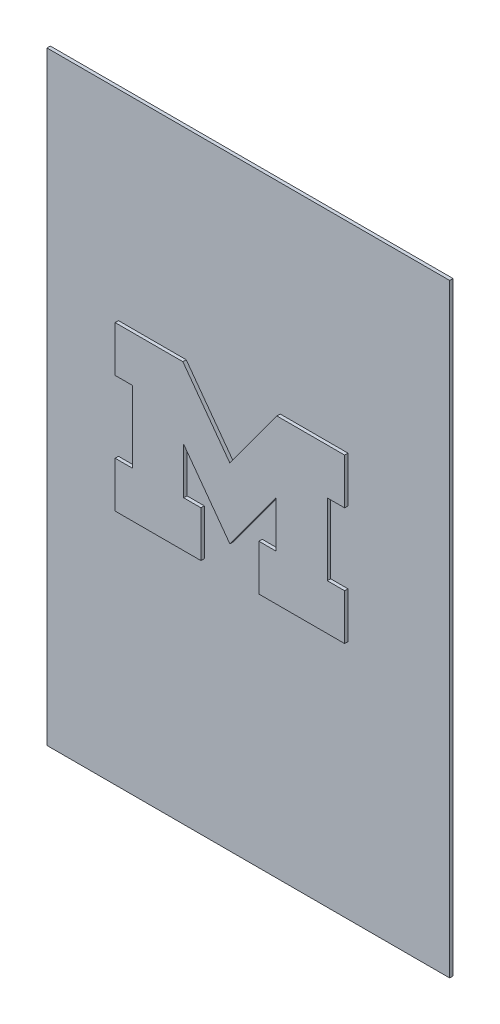
from build123d import *

# Parameters (mm, degrees)
SKETCH1_W           = 304.8
SKETCH1_H           = 457.2
BOSS_EXTRUDE1_DEPTH = 2.54
BOSS_EXTRUDE3_DEPTH = 2.54


with BuildPart() as part:
    # Sketch1 → Boss-Extrude1 (new body)
    with BuildSketch(Plane.XY):
        with Locations((152.4, 228.6)):
            Rectangle(SKETCH1_W, SKETCH1_H)
    extrude(amount=BOSS_EXTRUDE1_DEPTH)

    # Sketch3 → Boss-Extrude3 (add)
    with BuildSketch(Plane.XY.offset(2.54)):
        Polygon((144.017104059, 261.023321191), (140.977104059, 256.863321191), (137.937104059, 261.023321191), (105.409104059, 305.535321191), (54.116304059, 305.535321191), (54.116304059, 270.903321191), (67.220304059, 270.903321191), (67.220304059, 216.615321191), (54.116304059, 216.615321191), (54.116304059, 181.983321191), (119.074704059, 181.983321191), (119.074704059, 216.615321191), (105.970704059, 216.615321191), (105.970704059, 251.808921191), (140.977104059, 203.905426454), (175.983504059, 251.808921191), (175.983504059, 216.615321191), (162.879504059, 216.615321191), (162.879504059, 181.983321191), (227.837904059, 181.983321191), (227.837904059, 216.615321191), (214.733904059, 216.615321191), (214.733904059, 270.903321191), (227.837904059, 270.903321191), (227.837904059, 305.535321191), (176.545104059, 305.535321191), align=None)
    extrude(amount=BOSS_EXTRUDE3_DEPTH)


solid = part.part
